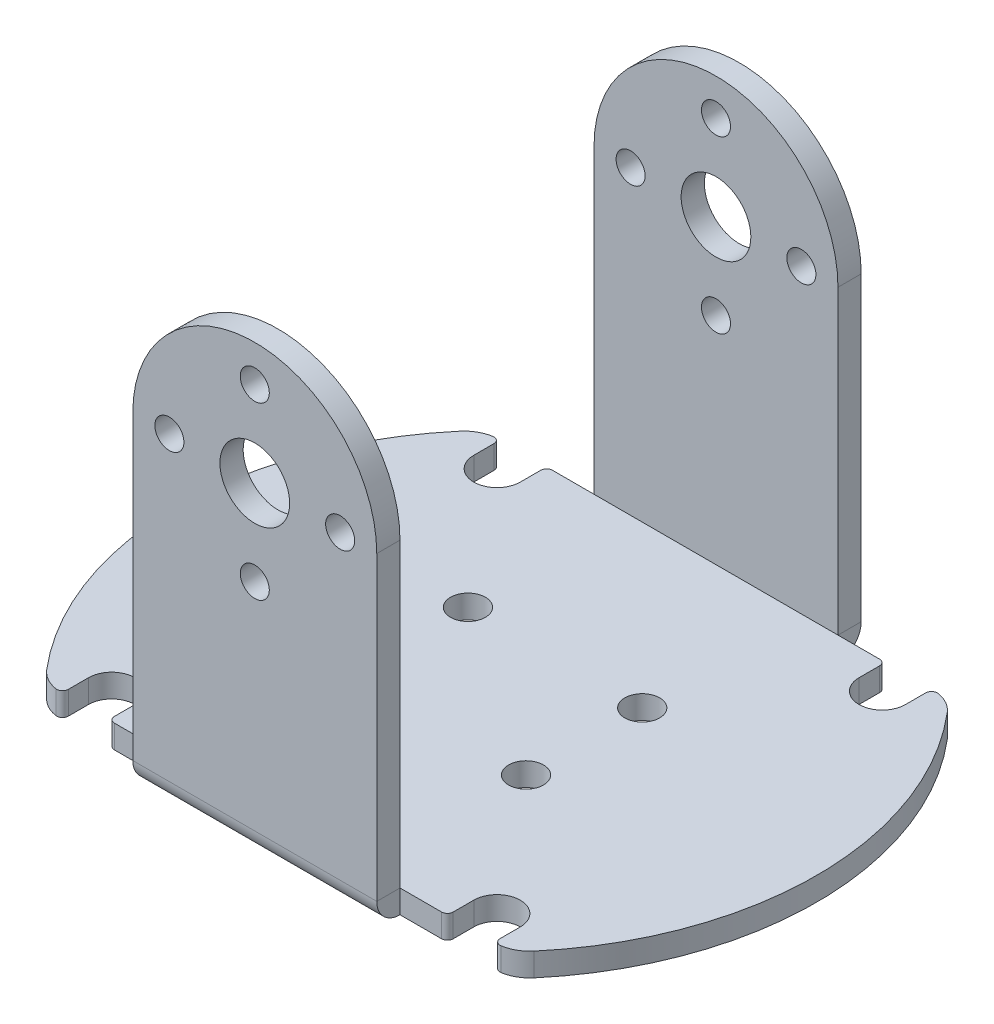
from build123d import *

# Parameters (mm, degrees)
BRIDA_BASE1_DEPTH               = 2
PLIEGUE_START                   = -10.5
PLIEGUE_CROQUIZADO2_DEPTH       = 21
PLIEGUE_CROQUIZADO2_2_OUTLINE_W = 36.429203673
PLIEGUE_CROQUIZADO2_2_OUTLINE_H = 2
PLIEGUE_CROQUIZADO2_2_DEPTH     = 21
CROQUIS9_R                      = 1.5
CORTAR_EXTRUIR1_DEPTH           = 51.180268834
CORTAR_EXTRUIR2_DEPTH           = 62.824160975
CORTAR_EXTRUIR2_DEPTH_BACK      = 62.824160975
CROQUIS10_R                     = 1.25
CROQUIS10_R_2                   = 3
REDONDEO3_R                     = 3
REDONDEO4_R                     = 0.5


# Read off the part's stored shape, not the designer's step: Pliegue croquizado2
# Sheet-metal steps are written as plain solids
with BuildPart() as part:
    # Croquis1 → Brida base1 (new body)
    with BuildSketch(Plane(origin=(0, 0, 0), x_dir=(1, 0, 0), z_dir=(0, 1, 0))):
        with BuildLine():
            Line((10.5, 18.85), (20.023174074, 18.85))
            ThreePointArc((20.023174074, 18.85), (27.5, 0), (20.023174074, -18.85))
            Line((20.023174074, -18.85), (10.5, -18.85))
            Line((10.5, -18.85), (10.5, -56.85))
            Line((10.5, -56.85), (-10.5, -56.85))
            Line((-10.5, -56.85), (-10.5, -18.85))
            Line((-10.5, -18.85), (-20.023174074, -18.85))
            ThreePointArc((-20.023174074, -18.85), (-27.5, 0), (-20.023174074, 18.85))
            Line((-20.023174074, 18.85), (-10.5, 18.85))
            Line((-10.5, 18.85), (-10.5, 56.85))
            Line((-10.5, 56.85), (10.5, 56.85))
            Line((10.5, 56.85), (10.5, 18.85))
        make_face()
    extrude(amount=-BRIDA_BASE1_DEPTH)

    # Pliegue croquizado2 outline → Pliegue croquizado2 (cut)
    with BuildSketch(Plane.YZ.offset(PLIEGUE_START)):
        with BuildLine():
            Line((0, -56.85), (0, -20.85))
            ThreePointArc((0, -20.85), (-1.414213562, -20.264213562), (-2, -18.85))
            Line((-2, -18.85), (-2, -56.85))
            Line((-2, -56.85), (0, -56.85))
        make_face()
        with BuildLine():
            Line((-2, 56.85), (-2, 18.85))
            ThreePointArc((-2, 18.85), (-1.414213562, 20.264213562), (0, 20.85))
            Line((0, 20.85), (0, 56.85))
            Line((0, 56.85), (-2, 56.85))
        make_face()
    extrude(amount=PLIEGUE_CROQUIZADO2_DEPTH, mode=Mode.SUBTRACT)

    # Pliegue croquizado2 2 outline → Pliegue croquizado2 2 (add)
    with BuildSketch(Plane.YZ.offset(PLIEGUE_START)):
        with Locations((18.214601837, -19.85)):
            Rectangle(PLIEGUE_CROQUIZADO2_2_OUTLINE_W, PLIEGUE_CROQUIZADO2_2_OUTLINE_H)
        with Locations((18.214601837, 19.85)):
            Rectangle(PLIEGUE_CROQUIZADO2_2_OUTLINE_W, PLIEGUE_CROQUIZADO2_2_OUTLINE_H)
    extrude(amount=PLIEGUE_CROQUIZADO2_2_DEPTH)

    # Croquis9 → Cortar-Extruir1 (cut, through all)
    with BuildSketch(Plane(origin=(0, 0, 0), x_dir=(1, 0, 0), z_dir=(0, 1, 0))):
        with Locations(Location((-7.5, 5, 0), (0, 0, 270))):
            Circle(CROQUIS9_R)
        with Locations(Location((-7.5, -5, 0), (0, 0, 270))):
            Circle(CROQUIS9_R)
        with Locations(Location((7.5, -5, 0), (0, 0, 270))):
            Circle(CROQUIS9_R)
        with Locations(Location((7.5, 5, 0), (0, 0, 270))):
            Circle(CROQUIS9_R)
        with BuildLine():
            Line((-18.5815, 16.5815), (-18.5815, 18.85))
            Line((-18.5815, 18.85), (-14.5815, 18.85))
            Line((-14.5815, 18.85), (-14.5815, 16.5815))
            ThreePointArc((-14.5815, 16.5815), (-16.5815, 14.5815), (-18.5815, 16.5815))
        make_face()
        with BuildLine():
            Line((14.5815, 18.85), (18.5815, 18.85))
            Line((18.5815, 18.85), (18.5815, 16.5815))
            ThreePointArc((18.5815, 16.5815), (16.5815, 14.5815), (14.5815, 16.5815))
            Line((14.5815, 16.5815), (14.5815, 18.85))
        make_face()
        with BuildLine():
            Line((14.5815, -18.85), (18.5815, -18.85))
            Line((18.5815, -18.85), (18.5815, -16.5815))
            ThreePointArc((18.5815, -16.5815), (16.5815, -14.5815), (14.5815, -16.5815))
            Line((14.5815, -16.5815), (14.5815, -18.85))
        make_face()
        with BuildLine():
            Line((-18.5815, -16.5815), (-18.5815, -18.85))
            Line((-18.5815, -18.85), (-14.5815, -18.85))
            Line((-14.5815, -18.85), (-14.5815, -16.5815))
            ThreePointArc((-14.5815, -16.5815), (-16.5815, -14.5815), (-18.5815, -16.5815))
        make_face()
    extrude(amount=-CORTAR_EXTRUIR1_DEPTH, mode=Mode.SUBTRACT)

    # Croquis10 → Cortar-Extruir2 (cut, two sides: drawn at the far end of the back side and taken through both)
    with BuildSketch(Plane.XY.offset(20.85).offset(-CORTAR_EXTRUIR2_DEPTH_BACK)):
        with BuildLine():
            ThreePointArc((-10.5, 25.929203673), (-7.424621199, 33.353824879), (8e-09, 36.429203673))
            Line((8e-09, 36.429203673), (-10.5, 36.429203673))
            Line((-10.5, 36.429203673), (-10.5, 25.929203673))
        make_face()
        with BuildLine():
            ThreePointArc((8e-09, 36.429203673), (7.424621205, 33.353824873), (10.5, 25.929203673))
            Line((10.5, 25.929203673), (10.5, 36.429203673))
            Line((10.5, 36.429203673), (8e-09, 36.429203673))
        make_face()
        with Locations(Location((0, 18.579203673, 0), (0, 0, 90))):
            Circle(CROQUIS10_R)
        with Locations(Location((0, 25.929203673, 0), (0, 0, 90))):
            Circle(CROQUIS10_R_2)
        with Locations(Location((7.35, 25.929203673, 0), (0, 0, 90))):
            Circle(CROQUIS10_R)
        with Locations(Location((0, 33.279203673, 0), (0, 0, 90))):
            Circle(CROQUIS10_R)
        with Locations(Location((-7.35, 25.929203673, 0), (0, 0, 90))):
            Circle(CROQUIS10_R)
    extrude(amount=CORTAR_EXTRUIR2_DEPTH + CORTAR_EXTRUIR2_DEPTH_BACK, mode=Mode.SUBTRACT)

    # Redondeo3
    redondeo3_edges = [part.edges().sort_by_distance(p)[0] for p in [
        (20.023174074, -1, -18.85),
        (20.023174074, -1, 18.85),
        (-20.023174074, -1, 18.85),
        (-20.023174074, -1, -18.85),
    ]]
    fillet(redondeo3_edges, radius=REDONDEO3_R)

    # Redondeo4
    redondeo4_edges = [part.edges().sort_by_distance(p)[0] for p in [
        (18.5815, -1, 18.85),
        (14.5815, -1, 18.85),
        (18.5815, -1, -18.85),
        (14.5815, -1, -18.85),
        (-18.5815, -1, 18.85),
        (-14.5815, -1, 18.85),
        (-18.5815, -1, -18.85),
        (-14.5815, -1, -18.85),
    ]]
    fillet(redondeo4_edges, radius=REDONDEO4_R)


solid = part.part
